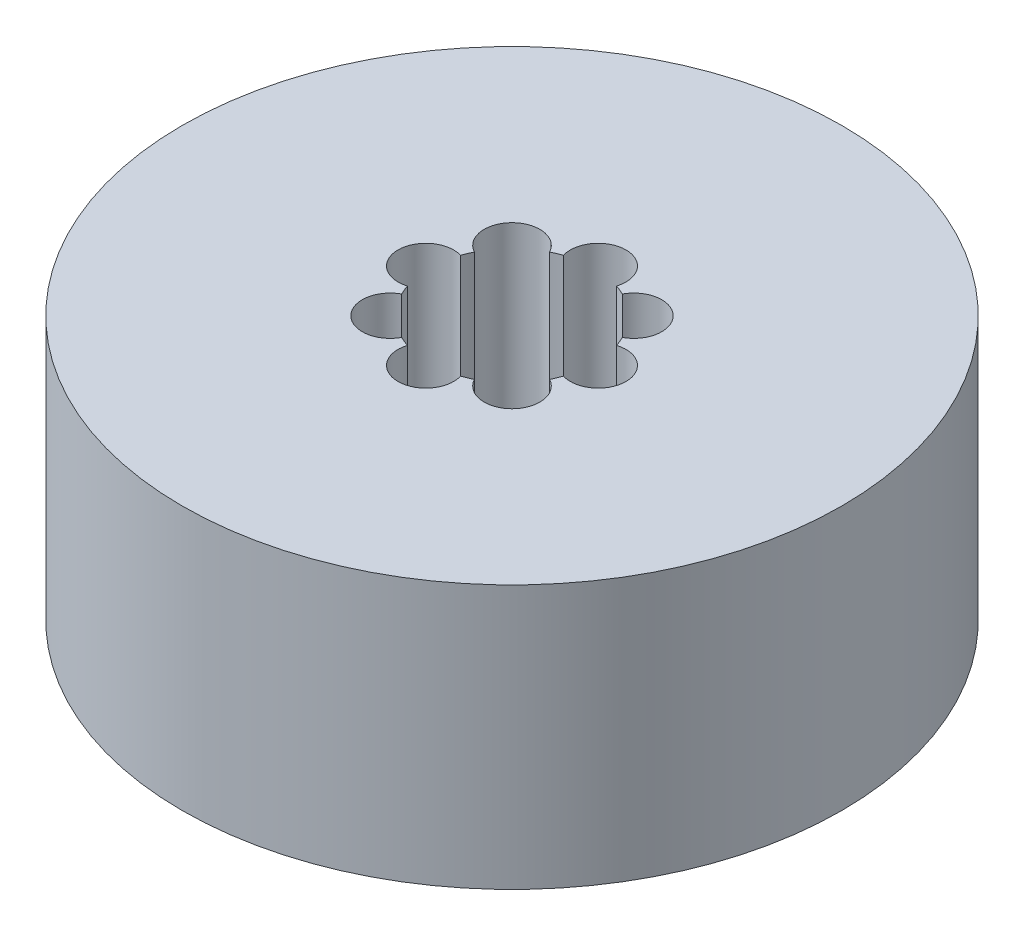
from build123d import *

# Parameters (mm, degrees)
SKETCH1_R           = 20
BOSS_EXTRUDE1_DEPTH = 16
SKETCH2_R           = 5
CUT_EXTRUDE1_DEPTH  = 33.496153619
SKETCH3_R           = 1.686994862
CUT_EXTRUDE2_DEPTH  = 12.358026313
CIRPATTERN1_COUNT   = 8


with BuildPart() as part:
    # Sketch1 → Boss-Extrude1 (new body)
    with BuildSketch(Plane(origin=(0, 0, 0), x_dir=(1, 0, 0), z_dir=(0, 1, 0))):
        Circle(SKETCH1_R)
    extrude(amount=BOSS_EXTRUDE1_DEPTH)

    # Sketch2 → Cut-Extrude1 (cut, through all)
    with BuildSketch(Plane(origin=(0, 0, 0), x_dir=(1, 0, 0), z_dir=(0, 1, 0))):
        Circle(SKETCH2_R)
    extrude(amount=CUT_EXTRUDE1_DEPTH, mode=Mode.SUBTRACT)

    # Sketch3 → Cut-Extrude2 (cut)
    with BuildSketch(Plane(origin=(0, 16, 0), x_dir=(1, 0, 0), z_dir=(0, 1, 0))):
        with Locations((-5.228133481, 0)):
            Circle(SKETCH3_R)
    cut_extrude2 = extrude(amount=-CUT_EXTRUDE2_DEPTH, mode=Mode.SUBTRACT)

    # CirPattern1: Cut-Extrude2 ×8 about axis
    cirpattern1_axis = Axis((0, 0, 0), (0, 1, 0))
    for i in range(1, CIRPATTERN1_COUNT):
        add(cut_extrude2.rotate(cirpattern1_axis, i * 360 / CIRPATTERN1_COUNT), mode=Mode.SUBTRACT)


solid = part.part
